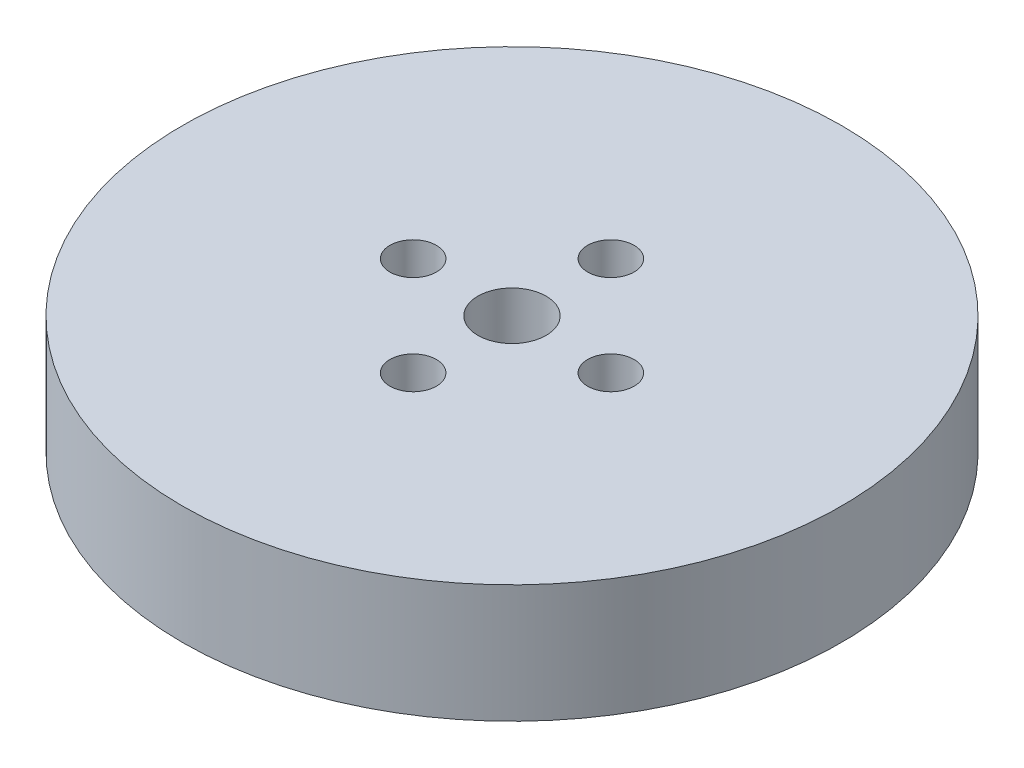
from build123d import *

# Parameters (mm, degrees)
SKETCH1_R           = 72.5
BOSS_EXTRUDE1_DEPTH = 26
SKETCH2_R           = 7.5
CUT_EXTRUDE1_DEPTH  = 106.775706095
SKETCH3_R           = 5.106535471
CUT_EXTRUDE2_DEPTH  = 21.663143679
CIRPATTERN1_COUNT   = 4


with BuildPart() as part:
    # Sketch1 → Boss-Extrude1 (new body)
    with BuildSketch(Plane(origin=(0, 0, 0), x_dir=(1, 0, 0), z_dir=(0, 1, 0))):
        Circle(SKETCH1_R)
    extrude(amount=BOSS_EXTRUDE1_DEPTH)

    # Sketch2 → Cut-Extrude1 (cut, through all)
    with BuildSketch(Plane(origin=(0, 0, 0), x_dir=(1, 0, 0), z_dir=(0, 1, 0))):
        Circle(SKETCH2_R)
    extrude(amount=CUT_EXTRUDE1_DEPTH, mode=Mode.SUBTRACT)

    # Sketch3 → Cut-Extrude2 (cut)
    with BuildSketch(Plane(origin=(0, 26, 0), x_dir=(1, 0, 0), z_dir=(0, 1, 0))):
        with Locations((-21.748809965, 0)):
            Circle(SKETCH3_R)
    cut_extrude2 = extrude(amount=-CUT_EXTRUDE2_DEPTH, mode=Mode.SUBTRACT)

    # CirPattern1: Cut-Extrude2 ×4 about axis
    cirpattern1_axis = Axis((0, 0, 0), (0, 1, 0))
    for i in range(1, CIRPATTERN1_COUNT):
        add(cut_extrude2.rotate(cirpattern1_axis, i * 360 / CIRPATTERN1_COUNT), mode=Mode.SUBTRACT)


solid = part.part
